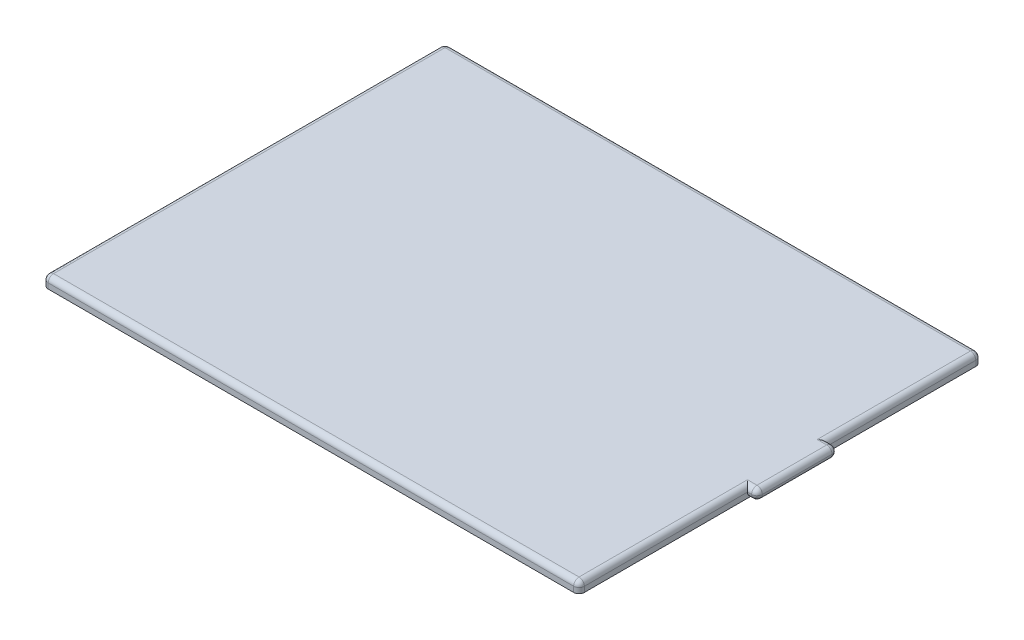
from build123d import *

# Parameters (mm, degrees)
SKETCH1_W           = 200
SKETCH1_H           = 150
BOSS_EXTRUDE1_DEPTH = 4
FILLET1_R           = 2
FILLET2_R           = 2
FILLET3_R           = 2
FILLET4_R           = 2
SKETCH2_W           = 8
SKETCH2_H           = 30
BOSS_EXTRUDE2_DEPTH = 4
FILLET5_R           = 2


# Some blends are built 0.0001 mm under size
with BuildPart() as part:
    # Sketch1 → Boss-Extrude1 (new body)
    with BuildSketch(Plane(origin=(0, 0, 0), x_dir=(1, 0, 0), z_dir=(0, 1, 0))):
        with Locations((-106.41025641, 19.711538462)):
            Rectangle(SKETCH1_W, SKETCH1_H)
    extrude(amount=BOSS_EXTRUDE1_DEPTH)

    # Fillet1
    fillet1_edges = [part.edges().sort_by_distance(p)[0] for p in [
        (-206.41025641, 4, -19.711538462),
        (-106.41025641, 4, -94.711538462),
    ]]
    fillet(fillet1_edges, radius=FILLET1_R)

    # Fillet2
    fillet2_edges = [part.edges().sort_by_distance(p)[0] for p in [
        (-105.41025641, 4, 55.288461538),
        (-206.41025641, 1, 55.288461538),
        (-205.824469973, 3.414213562, 55.288461538),
    ]]
    fillet(fillet2_edges, radius=FILLET2_R)

    # Fillet3
    fillet3_edges = [part.edges().sort_by_distance(p)[0] for p in [
        (-6.41025641, 1, -94.711538462),
        (-6.41025641, 3.414213562, -94.125752024),
        (-6.41025641, 1, 55.288461538),
        (-6.41025641, 4, -19.711538462),
        (-6.41025641, 3.414213562, 54.702675101),
    ]]
    fillet(fillet3_edges, radius=FILLET3_R)

    # Fillet4
    # the kernel refuses this fillet: 2 mm, written as the material it takes off along each edge
    with BuildSketch(Plane(origin=(-204.41025641, 2, -92.711538462), x_dir=(-1, 0, 0), z_dir=(0, 0, -1))) as fillet4_piece_1_section:
        Polygon((0, 0), (FILLET4_R, 0), (FILLET4_R, FILLET4_R), (0, FILLET4_R), align=None)
    fillet4_piece_1 = extrude(amount=FILLET4_R, mode=Mode.PRIVATE)
    fillet4_piece_1 = fillet4_piece_1 - Plane(origin=(-204.41025641, 2, -92.711538462), x_dir=(0.7071067811865475, -0.7071067811865475, 0), z_dir=(0, 0, -1)) * Sphere(FILLET4_R, mode=Mode.PRIVATE)
    add(fillet4_piece_1, mode=Mode.SUBTRACT)
    with BuildSketch(Plane(origin=(-206.41025641, -5, -94.711538462), x_dir=(1, 0, 0), z_dir=(0, 1, 0))) as fillet4_piece_2:
        with BuildLine():
            CenterArc((FILLET4_R, -FILLET4_R), FILLET4_R, 90, 90)
            Line((0, -FILLET4_R), (0, 0))
            Line((0, 0), (FILLET4_R, 0))
        make_face()
    extrude(amount=7, mode=Mode.SUBTRACT)

    # Sketch2 → Boss-Extrude2 (add)
    with BuildSketch(Plane(origin=(0, 4, 0), x_dir=(1, 0, 0), z_dir=(0, 1, 0))):
        with Locations((-6.865890451, 22.549136896)):
            Rectangle(SKETCH2_W, SKETCH2_H)
    extrude(amount=-BOSS_EXTRUDE2_DEPTH)

    # Fillet5
    fillet5_edges = [part.edges().sort_by_distance(p)[0] for p in [
        (-4.638073431, 0, -37.549136896),
    ]]
    fillet(fillet5_edges, radius=FILLET5_R)
    fillet5_2_edges = [part.edges().sort_by_distance(p)[0] for p in [
        (-2.865890451, 0, -21.549136896),
    ]]
    fillet(fillet5_2_edges, radius=FILLET5_R)
    fillet5_3_edges = [part.edges().sort_by_distance(p)[0] for p in [
        (-5.638073431, 0, -7.549136896),
    ]]
    fillet(fillet5_3_edges, radius=FILLET5_R)
    fillet5_4_edges = [part.edges().sort_by_distance(p)[0] for p in [
        (-6.638073431, 4, -37.549136896),
    ]]
    fillet(fillet5_4_edges, radius=FILLET5_R - 0.0001)  # a hair under: the kernel refuses the full size


solid = part.part
